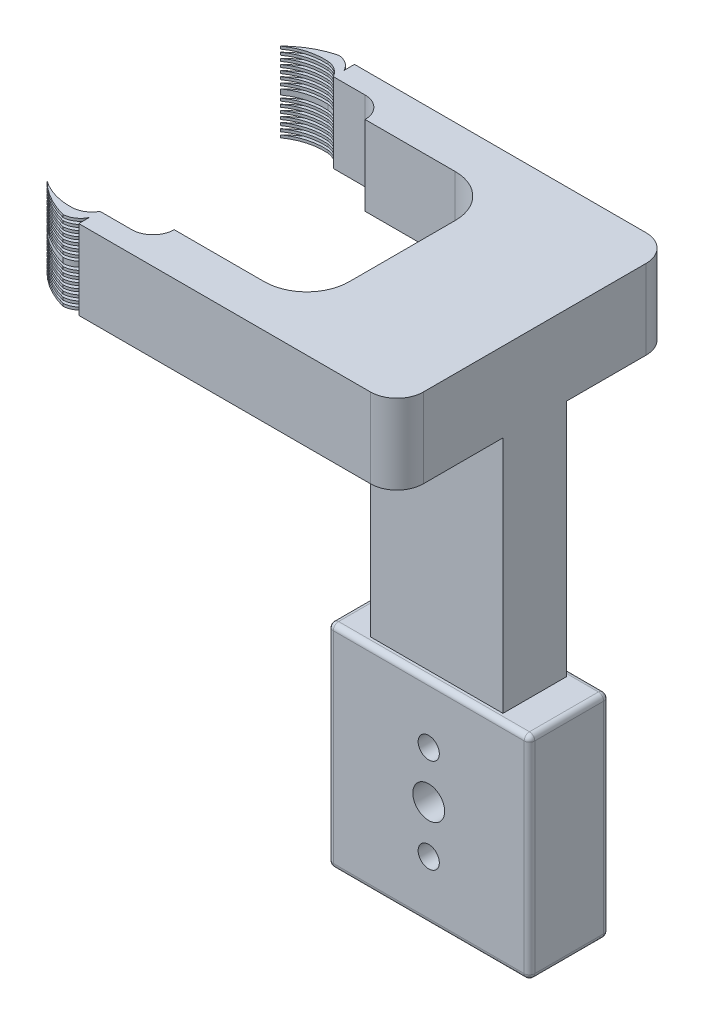
from build123d import *

# Parameters (mm, degrees)
SKETCH1_W           = 38
SKETCH1_H           = 40
BOSS_EXTRUDE1_DEPTH = 15
SKETCH2_W           = 25
SKETCH2_H           = 12
BOSS_EXTRUDE2_DEPTH = 60
SKETCH3_W           = 25
SKETCH3_H           = 15
BOSS_EXTRUDE3_DEPTH = 20
SKETCH4_W           = 25
SKETCH4_H           = 15
BOSS_EXTRUDE4_DEPTH = 20
SKETCH5_W           = 8
SKETCH5_H           = 15
BOSS_EXTRUDE5_DEPTH = 35
SKETCH6_W           = 4
SKETCH6_H           = 15
CUT_EXTRUDE1_DEPTH  = 10
SKETCH7_W           = 4
SKETCH7_H           = 15
CUT_EXTRUDE2_DEPTH  = 10
SKETCH8_W           = 4
SKETCH8_H           = 15
BOSS_EXTRUDE6_DEPTH = 10
CUT_EXTRUDE3_DEPTH  = 113.269764407
SKETCH11_W          = 10
SKETCH11_H          = 0.5
CUT_EXTRUDE5_DEPTH  = 120.106045187
FILLET1_R           = 8
FILLET2_R           = 8
FILLET3_R           = 4
FILLET4_R           = 4
FILLET5_R           = 5
FILLET6_R           = 1
FILLET7_R           = 1
FILLET8_R           = 1
FILLET9_R           = 1
SKETCH15_W          = 9.225349196
SKETCH15_H          = 17.793343258
CUT_EXTRUDE7_DEPTH  = 5
SKETCH16_R          = 2
SKETCH16_R_2        = 3
CUT_EXTRUDE8_DEPTH  = 111.880566377


# Some blends are built 0.0001 mm under size
with BuildPart() as part:
    # Sketch1 → Boss-Extrude1 (new body)
    with BuildSketch(Plane.XY):
        with Locations((19, 20)):
            Rectangle(SKETCH1_W, SKETCH1_H)
    extrude(amount=BOSS_EXTRUDE1_DEPTH)

    # Sketch2 → Boss-Extrude2 (add)
    with BuildSketch(Plane(origin=(0, 40, 0), x_dir=(1, 0, 0), z_dir=(0, 1, 0))):
        with Locations((19, -7.5)):
            Rectangle(SKETCH2_W, SKETCH2_H)
    extrude(amount=BOSS_EXTRUDE2_DEPTH)

    # Sketch3 → Boss-Extrude3 (add)
    with BuildSketch(Plane(origin=(0, 0, 1.5), x_dir=(-1, 0, 0), z_dir=(0, 0, -1))):
        with Locations((-19, 92.5)):
            Rectangle(SKETCH3_W, SKETCH3_H)
    extrude(amount=BOSS_EXTRUDE3_DEPTH)

    # Sketch4 → Boss-Extrude4 (add)
    with BuildSketch(Plane.XY.offset(13.5)):
        with Locations((19, 92.5)):
            Rectangle(SKETCH4_W, SKETCH4_H)
    extrude(amount=BOSS_EXTRUDE4_DEPTH)

    # Sketch5 → Boss-Extrude5 (add)
    with BuildSketch(Plane.ZY.offset(-6.5)):
        with Locations((-14.5, 92.5)):
            Rectangle(SKETCH5_W, SKETCH5_H)
        with Locations((29.5, 92.5)):
            Rectangle(SKETCH5_W, SKETCH5_H)
    extrude(amount=BOSS_EXTRUDE5_DEPTH)

    # Sketch6 → Cut-Extrude1 (cut)
    with BuildSketch(Plane.ZY.offset(28.5)):
        with Locations((-12.5, 92.5)):
            Rectangle(SKETCH6_W, SKETCH6_H)
    extrude(amount=-CUT_EXTRUDE1_DEPTH, mode=Mode.SUBTRACT)

    # Sketch7 → Cut-Extrude2 (cut)
    with BuildSketch(Plane.ZY.offset(28.5)):
        with Locations((27.5, 92.5)):
            Rectangle(SKETCH7_W, SKETCH7_H)
    extrude(amount=-CUT_EXTRUDE2_DEPTH, mode=Mode.SUBTRACT)

    # Sketch8 → Boss-Extrude6 (add)
    with BuildSketch(Plane.ZY.offset(28.5)):
        with Locations((-16.5, 92.5)):
            Rectangle(SKETCH8_W, SKETCH8_H)
    boss_extrude6 = extrude(amount=BOSS_EXTRUDE6_DEPTH)

    # Sketch9 → Cut-Extrude3 (cut, through all)
    with BuildSketch(Plane(origin=(0, 100, 0), x_dir=(1, 0, 0), z_dir=(0, 1, 0))):
        with BuildLine():
            ThreePointArc((-31.5, 16.5), (-35.173466246, 16.107131861), (-38.5, 14.5))
            Line((-38.5, 14.5), (-28.5, 14.5))
            ThreePointArc((-28.5, 14.5), (-29.75057598, 15.874136031), (-31.5, 16.5))
        make_face()
        with BuildLine():
            Line((-28.5, 18.5), (-31.5, 18.5))
            ThreePointArc((-31.5, 18.5), (-29.718791901, 17.921812148), (-28.5, 16.5))
            Line((-28.5, 16.5), (-28.5, 18.5))
        make_face()
        with BuildLine():
            ThreePointArc((-38.5, 14.5), (-35.263944483, 16.961902845), (-31.5, 18.5))
            Line((-31.5, 18.5), (-38.5, 18.5))
            Line((-38.5, 18.5), (-38.5, 14.5))
        make_face()
    cut_extrude3 = extrude(amount=-CUT_EXTRUDE3_DEPTH, mode=Mode.SUBTRACT)

    # Sketch11 → Cut-Extrude5 (cut, through all)
    with BuildSketch(Plane(origin=(0, 0, -18.5), x_dir=(-1, 0, 0), z_dir=(0, 0, -1))):
        with Locations((33.5, 99.25)):
            Rectangle(SKETCH11_W, SKETCH11_H)
        with Locations((33.5, 98.25)):
            Rectangle(SKETCH11_W, SKETCH11_H)
        with Locations((33.5, 97.25)):
            Rectangle(SKETCH11_W, SKETCH11_H)
        with Locations((33.5, 96.25)):
            Rectangle(SKETCH11_W, SKETCH11_H)
        with Locations((33.5, 95.25)):
            Rectangle(SKETCH11_W, SKETCH11_H)
        with Locations((33.5, 94.25)):
            Rectangle(SKETCH11_W, SKETCH11_H)
        with Locations((33.5, 93.25)):
            Rectangle(SKETCH11_W, SKETCH11_H)
        with Locations((33.5, 91.75)):
            Rectangle(SKETCH11_W, SKETCH11_H)
        with Locations((33.5, 90.75)):
            Rectangle(SKETCH11_W, SKETCH11_H)
        with Locations((33.5, 89.75)):
            Rectangle(SKETCH11_W, SKETCH11_H)
        with Locations((33.5, 88.75)):
            Rectangle(SKETCH11_W, SKETCH11_H)
        with Locations((33.5, 87.75)):
            Rectangle(SKETCH11_W, SKETCH11_H)
        with Locations((33.5, 86.75)):
            Rectangle(SKETCH11_W, SKETCH11_H)
        with Locations((33.5, 85.75)):
            Rectangle(SKETCH11_W, SKETCH11_H)
    cut_extrude5 = extrude(amount=-CUT_EXTRUDE5_DEPTH, mode=Mode.SUBTRACT)

    # Mirror3: Boss-Extrude6 across plane
    add(boss_extrude6.mirror(Plane.XY.offset(7.5)))

    # Mirror5: Cut-Extrude3 across plane
    add(cut_extrude3.mirror(Plane.XY.offset(7.5)), mode=Mode.SUBTRACT)

    # Mirror6: Cut-Extrude5 across plane
    add(cut_extrude5.mirror(Plane.XY.offset(7.5)), mode=Mode.SUBTRACT)

    # Fillet1
    fillet1_edges = [part.edges().sort_by_distance(p)[0] for p in [
        (6.5, 92.5, -10.5),
    ]]
    fillet(fillet1_edges, radius=FILLET1_R)

    # Fillet2
    fillet2_edges = [part.edges().sort_by_distance(p)[0] for p in [
        (6.5, 92.5, 25.5),
    ]]
    fillet(fillet2_edges, radius=FILLET2_R)

    # Fillet3
    fillet3_edges = [part.edges().sort_by_distance(p)[0] for p in [
        (-18.5, 92.5, 29.5),
    ]]
    fillet(fillet3_edges, radius=FILLET3_R - 0.0001)  # a hair under: the kernel refuses the full size

    # Fillet4
    fillet4_edges = [part.edges().sort_by_distance(p)[0] for p in [
        (-18.5, 92.5, -14.5),
    ]]
    fillet(fillet4_edges, radius=FILLET4_R - 0.0001)  # a hair under: the kernel refuses the full size

    # Fillet5
    fillet5_edges = [part.edges().sort_by_distance(p)[0] for p in [
        (31.5, 92.5, -18.5),
        (31.5, 92.5, 33.5),
    ]]
    fillet(fillet5_edges, radius=FILLET5_R)

    # Fillet6
    fillet6_edges = [part.edges().sort_by_distance(p)[0] for p in [
        (19, 40, 15),
        (19, 40, 0),
        (0, 40, 7.5),
        (38, 40, 7.5),
        (38, 0, 7.5),
        (19, 0, 15),
    ]]
    fillet(fillet6_edges, radius=FILLET6_R)

    # Fillet7
    # the kernel refuses this fillet: 1 mm, written as the material it takes off along each edge
    with BuildSketch(Plane(origin=(37, 39, 1), x_dir=(0, 0, -1), z_dir=(1, 0, 0))) as fillet7_piece_1_section:
        Polygon((0, 0), (FILLET7_R, 0), (FILLET7_R, FILLET7_R), (0, FILLET7_R), align=None)
    fillet7_piece_1 = extrude(amount=FILLET7_R, mode=Mode.PRIVATE)
    fillet7_piece_1 = fillet7_piece_1 - Plane(origin=(37, 39, 1), x_dir=(0, -0.7071067811865475, 0.7071067811865475), z_dir=(1, 0, 0)) * Sphere(FILLET7_R, mode=Mode.PRIVATE)
    add(fillet7_piece_1, mode=Mode.SUBTRACT)
    with BuildSketch(Plane(origin=(1, 39, 14), x_dir=(-1, 0, 0), z_dir=(0, 0, 1))) as fillet7_piece_2_section:
        Polygon((0, 0), (FILLET7_R, 0), (FILLET7_R, -FILLET7_R), (0, -FILLET7_R), align=None)
    fillet7_piece_2 = extrude(amount=FILLET7_R, mode=Mode.PRIVATE)
    fillet7_piece_2 = fillet7_piece_2 - Plane(origin=(1, 39, 14), x_dir=(0.7071067811865475, -0.7071067811865475, 0), z_dir=(0, 0, 1)) * Sphere(FILLET7_R, mode=Mode.PRIVATE)
    add(fillet7_piece_2, mode=Mode.SUBTRACT)
    with BuildSketch(Plane(origin=(38, 1, 0), x_dir=(0, 0, 1), z_dir=(0, 1, 0)), Plane(origin=(0, 39, 15), x_dir=(1, 0, 0), z_dir=(0, -1, 0))) as fillet7_piece_3:
        with BuildLine():
            CenterArc((FILLET7_R, -FILLET7_R), FILLET7_R, 90, 90)
            Line((0, -FILLET7_R), (0, 0))
            Line((0, 0), (FILLET7_R, 0))
        make_face()
    extrude(amount=38, mode=Mode.SUBTRACT)
    with BuildSketch(Plane(origin=(37, 1, 0), x_dir=(1, 0, 0), z_dir=(0, 1, 0))) as fillet7_piece_4:
        with BuildLine():
            CenterArc((1 - FILLET7_R, -FILLET7_R), FILLET7_R, 0, 90)
            Line((1, -FILLET7_R), (1, 0))
            Line((1, 0), (1 - FILLET7_R, 0))
        make_face()
    revolve(axis=Axis((37, 1, 0), (0, 0, -1)), revolution_arc=90, mode=Mode.SUBTRACT)
    with BuildSketch(Plane(origin=(0, 0, -2.5), x_dir=(0, 1, 0), z_dir=(0, 0, 1))) as fillet7_piece_5:
        with BuildLine():
            CenterArc((FILLET7_R, -FILLET7_R), FILLET7_R, 90, 90)
            Line((0, -FILLET7_R), (0, 0))
            Line((0, 0), (FILLET7_R, 0))
        make_face()
    extrude(amount=16.5, mode=Mode.SUBTRACT)
    with BuildSketch(Plane(origin=(0, 1, 14), x_dir=(0, 0, 1), z_dir=(0, 1, 0))) as fillet7_piece_6:
        with BuildLine():
            CenterArc((1 - FILLET7_R, FILLET7_R), FILLET7_R, 270, 90)
            Line((1, FILLET7_R), (1, 0))
            Line((1, 0), (1 - FILLET7_R, 0))
        make_face()
    revolve(axis=Axis((0, 1, 14), (1, 0, 0)), revolution_arc=90, mode=Mode.SUBTRACT)
    with BuildSketch(Plane(origin=(-2.5, 0, 0), x_dir=(0, 1, 0), z_dir=(1, 0, 0))) as fillet7_piece_7:
        with BuildLine():
            CenterArc((FILLET7_R, FILLET7_R), FILLET7_R, 180, 90)
            Line((0, FILLET7_R), (0, 0))
            Line((0, 0), (FILLET7_R, 0))
        make_face()
    extrude(amount=39.5, mode=Mode.SUBTRACT)

    # Fillet8
    # the kernel refuses this fillet: 1 mm, written as the material it takes off along each edge
    with BuildSketch(Plane(origin=(37, 1, 14), x_dir=(1, 0, 0), z_dir=(0, 0, 1))) as fillet8_piece_1_section:
        Polygon((0, 0), (FILLET8_R, 0), (FILLET8_R, -FILLET8_R), (0, -FILLET8_R), align=None)
    fillet8_piece_1 = extrude(amount=FILLET8_R, mode=Mode.PRIVATE)
    fillet8_piece_1 = fillet8_piece_1 - Plane(origin=(37, 1, 14), x_dir=(-0.7071067811865475, 0.7071067811865475, 0), z_dir=(0, 0, 1)) * Sphere(FILLET8_R, mode=Mode.PRIVATE)
    add(fillet8_piece_1, mode=Mode.SUBTRACT)
    with BuildSketch(Plane(origin=(37, 39, 14), x_dir=(1, 0, 0), z_dir=(0, 0, 1))) as fillet8_piece_2_section:
        Polygon((0, 0), (FILLET8_R, 0), (FILLET8_R, FILLET8_R), (0, FILLET8_R), align=None)
    fillet8_piece_2 = extrude(amount=FILLET8_R, mode=Mode.PRIVATE)
    fillet8_piece_2 = fillet8_piece_2 - Plane(origin=(37, 39, 14), x_dir=(-0.7071067811865475, -0.7071067811865475, 0), z_dir=(0, 0, 1)) * Sphere(FILLET8_R, mode=Mode.PRIVATE)
    add(fillet8_piece_2, mode=Mode.SUBTRACT)
    with BuildSketch(Plane(origin=(38, 1, 15), x_dir=(-1, 0, 0), z_dir=(0, 1, 0))) as fillet8_piece_3:
        with BuildLine():
            CenterArc((FILLET8_R, -FILLET8_R), FILLET8_R, 90, 90)
            Line((0, -FILLET8_R), (0, 0))
            Line((0, 0), (FILLET8_R, 0))
        make_face()
    extrude(amount=38, mode=Mode.SUBTRACT)

    # Fillet9
    # the kernel refuses this fillet: 1 mm, written as the material it takes off along each edge
    with BuildSketch(Plane(origin=(1, 39, 1), x_dir=(0, 0, -1), z_dir=(-1, 0, 0))) as fillet9_piece_1_section:
        Polygon((0, 0), (FILLET9_R, 0), (FILLET9_R, -FILLET9_R), (0, -FILLET9_R), align=None)
    fillet9_piece_1 = extrude(amount=FILLET9_R, mode=Mode.PRIVATE)
    fillet9_piece_1 = fillet9_piece_1 - Plane(origin=(1, 39, 1), x_dir=(0, -0.7071067811865475, 0.7071067811865475), z_dir=(-1, 0, 0)) * Sphere(FILLET9_R, mode=Mode.PRIVATE)
    add(fillet9_piece_1, mode=Mode.SUBTRACT)
    with BuildSketch(Plane(origin=(1, 1, 1), x_dir=(0, 0, -1), z_dir=(-1, 0, 0))) as fillet9_piece_2_section:
        Polygon((0, 0), (FILLET9_R, 0), (FILLET9_R, FILLET9_R), (0, FILLET9_R), align=None)
    fillet9_piece_2 = extrude(amount=FILLET9_R, mode=Mode.PRIVATE)
    fillet9_piece_2 = fillet9_piece_2 - Plane(origin=(1, 1, 1), x_dir=(0, 0.7071067811865475, 0.7071067811865475), z_dir=(-1, 0, 0)) * Sphere(FILLET9_R, mode=Mode.PRIVATE)
    add(fillet9_piece_2, mode=Mode.SUBTRACT)
    with BuildSketch(Plane(origin=(0, 39, 0), x_dir=(0, 0, 1), z_dir=(0, -1, 0))) as fillet9_piece_3:
        with BuildLine():
            CenterArc((FILLET9_R, -FILLET9_R), FILLET9_R, 90, 90)
            Line((0, -FILLET9_R), (0, 0))
            Line((0, 0), (FILLET9_R, 0))
        make_face()
    extrude(amount=38, mode=Mode.SUBTRACT)

    # Sketch15 → Cut-Extrude7 (cut)
    with BuildSketch(Plane(origin=(0, 0, 0), x_dir=(-1, 0, 0), z_dir=(0, 0, -1))):
        with BuildLine():
            Line((-23.612674598, 28.896671629), (-14.387325402, 28.896671629))
            ThreePointArc((-14.387325402, 28.896671629), (-19, 33.509346228), (-23.612674598, 28.896671629))
        make_face()
        with Locations((-19, 20)):
            Rectangle(SKETCH15_W, SKETCH15_H)
        with BuildLine():
            ThreePointArc((-14.387325402, 11.103328371), (-19, 6.490653772), (-23.612674598, 11.103328371))
            Line((-23.612674598, 11.103328371), (-14.387325402, 11.103328371))
        make_face()
    extrude(amount=-CUT_EXTRUDE7_DEPTH, mode=Mode.SUBTRACT)

    # Sketch16 → Cut-Extrude8 (cut, through all)
    with BuildSketch(Plane(origin=(0, 0, 5), x_dir=(-1, 0, 0), z_dir=(0, 0, -1))):
        with Locations((-19, 28.896671629)):
            Circle(SKETCH16_R)
        with Locations((-19, 11.103328371)):
            Circle(SKETCH16_R)
        with Locations((-19, 20)):
            Circle(SKETCH16_R_2)
    extrude(amount=-CUT_EXTRUDE8_DEPTH, mode=Mode.SUBTRACT)


solid = part.part
